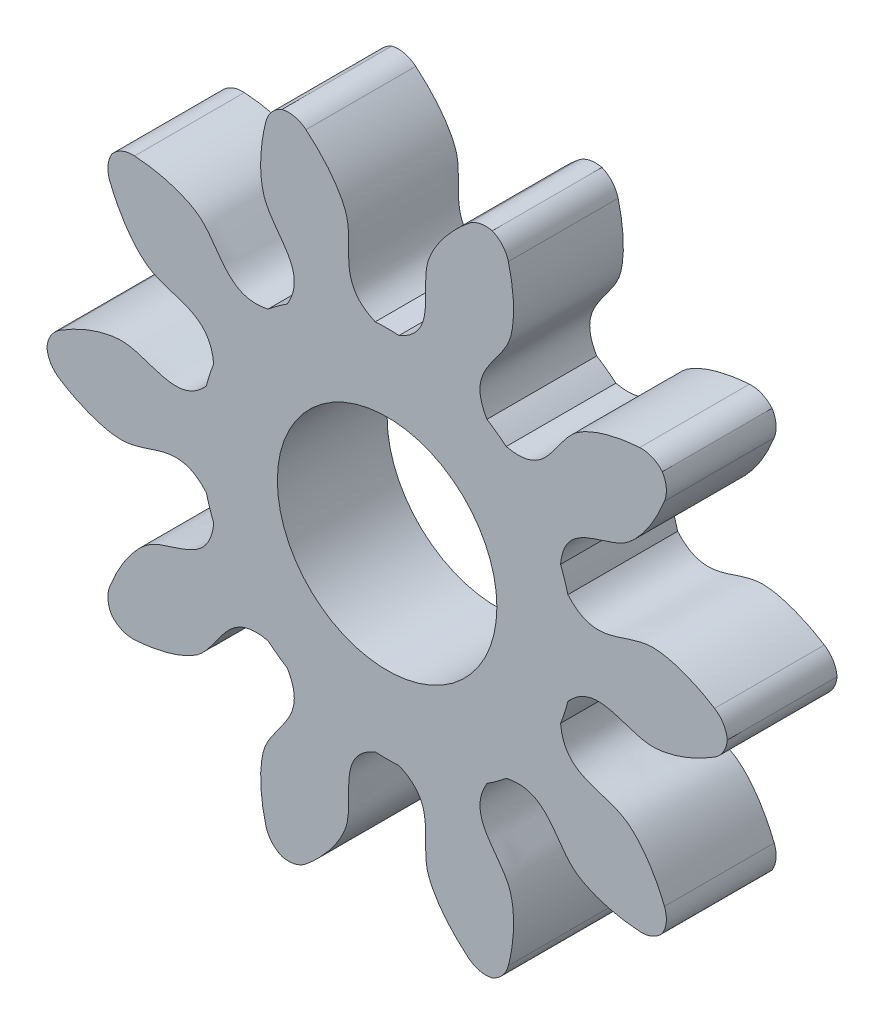
from build123d import *

# Parameters (mm, degrees)
SKETCH_1_R               = 6.2
EXTRUDE_1_DEPTH          = 2
CUT_EXTRUDE_1_DEPTH      = 9.993330862
PATTERN_CIRCULAR_1_COUNT = 10
FILLET_START             = -1
FILLET_1_DEPTH           = 4
PATTERN_CIRCULAR_2_COUNT = 10
SKETCH_4_R               = 2
CUT_EXTRUDE_2_DEPTH      = 9.794049568


with BuildPart() as part:
    # 草图1 → 凸台-拉伸1 (new body)
    with BuildSketch(Plane.XY):
        Circle(SKETCH_1_R)
    extrude(amount=EXTRUDE_1_DEPTH)

    # 草图2 → 切除-拉伸1 (cut, through all)
    with BuildSketch(Plane.XY):
        with BuildLine():
            ThreePointArc((0.216461071, 3.393102504), (0, 3.4), (-0.216461071, 3.393102504))
            add(Edge.make_bspline(
                [(-0.216461071, 3.393102504), (-0.938538331, 3.702538671), (-0.587766178, 4.361002055), (-0.755043124, 4.860887482), (-0.76122395, 4.878213624), (-0.768437165, 4.897223258), (-0.776750957, 4.917881586), (-0.786234278, 4.940151385), (-0.79695448, 4.963993454), (-0.808977961, 4.989366515), (-0.822369902, 5.016227278), (-0.837194274, 5.044530464), (-0.853513767, 5.074228838), (-0.87138974, 5.10527324), (-0.890882173, 5.137612624), (-0.912049612, 5.171194089), (-0.934949121, 5.20596292), (-0.95963623, 5.241862624), (-0.986164895, 5.278834969), (-1.014587439, 5.31682003), (-1.044954517, 5.355756224), (-1.077315063, 5.395580357), (-1.11171625, 5.436227669), (-1.148203448, 5.477631878), (-1.186820177, 5.519725226), (-1.227608074, 5.562438528), (-1.270606844, 5.605701218), (-1.315854232, 5.649441405), (-1.363385978, 5.693585914), (-1.413235784, 5.738060347), (-1.465435281, 5.782789128), (-1.520013993, 5.827695561), (-1.576999308, 5.872701882), (-1.636416442, 5.917729317), (-1.698288417, 5.962698132), (-1.762636028, 6.007527695), (-1.829477818, 6.052136532), (-1.898830051, 6.096442384), (-1.970706693, 6.140362265), (-2.045119386, 6.183812523), (-2.122077425, 6.2267089), (-2.201587745, 6.268966591), (-2.283654899, 6.310500306), (-2.368281041, 6.351224332), (-2.455465914, 6.391052592), (-2.545206835, 6.429898712), (-2.637498682, 6.467676079), (-2.732333887, 6.504297907), (-2.829702424, 6.539677301), (-2.929591804, 6.573727317), (-3.031987069, 6.60636103), (-3.136870786, 6.637491596), (-3.244223049, 6.667032315), (-3.354021472, 6.694896698), (-3.466241195, 6.720998532), (-3.580854886, 6.74525194), (-3.697832739, 6.76757145), (-3.817142488, 6.787872057), (-3.938749409, 6.80606929), (-4.062616327, 6.822079272), (-4.188703632, 6.835818791), (-4.316969286, 6.847205355), (-4.44736884, 6.856157263), (-4.579855445, 6.862593668), (-4.714379872, 6.866434634), (-4.85089053, 6.867601208), (-4.989333483, 6.866015474), (-5.129652475, 6.861600622), (-5.271788949, 6.854281006), (-5.415682074, 6.843982203), (-5.561268772, 6.830631082), (-5.708483742, 6.814155854), (-5.857259491, 6.794486139), (-6.007526363, 6.771553021), (-6.159212575, 6.745289109), (-6.312244245, 6.715628592), (-6.46654543, 6.682507298), (-6.622038162, 6.645862747), (-6.778642483, 6.605634211), (-6.936276489, 6.561762765), (-7.094856367, 6.51419134), (-7.254296437, 6.462864779), (-7.414509197, 6.407729886), (-7.575405364, 6.348735476), (-7.736893924, 6.28583243), (-7.898882176, 6.218973738), (-8.061275785, 6.148114546), (-8.223978816, 6.073212213), (-8.442360448, 5.967334523), (-8.604560645, 5.882562478), (-8.712098668, 5.823620802)],
                knots=[0, 0, 0, 0, 0.148596065, 0.150177563, 0.151945119, 0.153898734, 0.156038407, 0.158364139, 0.160875929, 0.163573778, 0.166457686, 0.169527652, 0.172783677, 0.17622576, 0.179853902, 0.183668102, 0.187668361, 0.191854678, 0.196227054, 0.200785489, 0.205529982, 0.210460534, 0.215577144, 0.220879813, 0.22636854, 0.232043326, 0.23790417, 0.243951073, 0.250184035, 0.256603055, 0.263208133, 0.26999927, 0.276976466, 0.28413972, 0.291489033, 0.299024405, 0.306745835, 0.314653323, 0.32274687, 0.331026476, 0.33949214, 0.348143862, 0.356981644, 0.366005483, 0.375215382, 0.384611339, 0.394193354, 0.403961428, 0.413915561, 0.424055752, 0.434382001, 0.44489431, 0.455592676, 0.466477102, 0.477547586, 0.488804128, 0.500246729, 0.511875388, 0.523690106, 0.535690883, 0.547877718, 0.560250612, 0.572809564, 0.585554575, 0.598485644, 0.611602772, 0.624905959, 0.638395204, 0.652070507, 0.66593187, 0.67997929, 0.69421277, 0.708632307, 0.723237904, 0.738029559, 0.753007272, 0.768171044, 0.783520875, 0.799056764, 0.814778711, 0.830686718, 0.846780782, 0.863060906, 0.879527087, 0.896179328, 0.913017627, 0.930041984, 0.9472524, 0.964648875, 1, 1, 1, 1], degree=3))
            ThreePointArc((-8.712098668, 5.823620802), (0, 10.479275855), (8.712098668, 5.823620802))
            add(Edge.make_bspline(
                [(0.216461071, 3.393102504), (0.938538331, 3.702538671), (0.587766178, 4.361002055), (0.755043124, 4.860887482), (0.76122395, 4.878213624), (0.768437165, 4.897223258), (0.776750957, 4.917881586), (0.786234278, 4.940151385), (0.79695448, 4.963993454), (0.808977961, 4.989366515), (0.822369902, 5.016227278), (0.837194274, 5.044530464), (0.853513767, 5.074228838), (0.87138974, 5.10527324), (0.890882173, 5.137612624), (0.912049612, 5.171194089), (0.934949121, 5.20596292), (0.95963623, 5.241862624), (0.986164895, 5.278834969), (1.014587439, 5.31682003), (1.044954517, 5.355756224), (1.077315063, 5.395580357), (1.11171625, 5.436227669), (1.148203448, 5.477631878), (1.186820177, 5.519725226), (1.227608074, 5.562438528), (1.270606844, 5.605701218), (1.315854232, 5.649441405), (1.363385978, 5.693585914), (1.413235784, 5.738060347), (1.465435281, 5.782789128), (1.520013993, 5.827695561), (1.576999308, 5.872701882), (1.636416442, 5.917729317), (1.698288417, 5.962698132), (1.762636028, 6.007527695), (1.829477818, 6.052136532), (1.898830051, 6.096442384), (1.970706693, 6.140362265), (2.045119386, 6.183812523), (2.122077425, 6.2267089), (2.201587745, 6.268966591), (2.283654899, 6.310500306), (2.368281041, 6.351224332), (2.455465914, 6.391052592), (2.545206835, 6.429898712), (2.637498682, 6.467676079), (2.732333887, 6.504297907), (2.829702424, 6.539677301), (2.929591804, 6.573727317), (3.031987069, 6.60636103), (3.136870786, 6.637491596), (3.244223049, 6.667032315), (3.354021472, 6.694896698), (3.466241195, 6.720998532), (3.580854886, 6.74525194), (3.697832739, 6.76757145), (3.817142488, 6.787872057), (3.938749409, 6.80606929), (4.062616327, 6.822079272), (4.188703632, 6.835818791), (4.316969286, 6.847205355), (4.44736884, 6.856157263), (4.579855445, 6.862593668), (4.714379872, 6.866434634), (4.85089053, 6.867601208), (4.989333483, 6.866015474), (5.129652475, 6.861600622), (5.271788949, 6.854281006), (5.415682074, 6.843982203), (5.561268772, 6.830631082), (5.708483742, 6.814155854), (5.857259491, 6.794486139), (6.007526363, 6.771553021), (6.159212575, 6.745289109), (6.312244245, 6.715628592), (6.46654543, 6.682507298), (6.622038162, 6.645862747), (6.778642483, 6.605634211), (6.936276489, 6.561762765), (7.094856367, 6.51419134), (7.254296437, 6.462864779), (7.414509197, 6.407729886), (7.575405364, 6.348735476), (7.736893924, 6.28583243), (7.898882176, 6.218973738), (8.061275785, 6.148114546), (8.223978816, 6.073212213), (8.442360448, 5.967334523), (8.604560645, 5.882562478), (8.712098668, 5.823620802)],
                knots=[0, 0, 0, 0, 0.148596065, 0.150177563, 0.151945119, 0.153898734, 0.156038407, 0.158364139, 0.160875929, 0.163573778, 0.166457686, 0.169527652, 0.172783677, 0.17622576, 0.179853902, 0.183668102, 0.187668361, 0.191854678, 0.196227054, 0.200785489, 0.205529982, 0.210460534, 0.215577144, 0.220879813, 0.22636854, 0.232043326, 0.23790417, 0.243951073, 0.250184035, 0.256603055, 0.263208133, 0.26999927, 0.276976466, 0.28413972, 0.291489033, 0.299024405, 0.306745835, 0.314653323, 0.32274687, 0.331026476, 0.33949214, 0.348143862, 0.356981644, 0.366005483, 0.375215382, 0.384611339, 0.394193354, 0.403961428, 0.413915561, 0.424055752, 0.434382001, 0.44489431, 0.455592676, 0.466477102, 0.477547586, 0.488804128, 0.500246729, 0.511875388, 0.523690106, 0.535690883, 0.547877718, 0.560250612, 0.572809564, 0.585554575, 0.598485644, 0.611602772, 0.624905959, 0.638395204, 0.652070507, 0.66593187, 0.67997929, 0.69421277, 0.708632307, 0.723237904, 0.738029559, 0.753007272, 0.768171044, 0.783520875, 0.799056764, 0.814778711, 0.830686718, 0.846780782, 0.863060906, 0.879527087, 0.896179328, 0.913017627, 0.930041984, 0.9472524, 0.964648875, 1, 1, 1, 1], degree=3))
        make_face()
    cut_extrude_1 = extrude(amount=CUT_EXTRUDE_1_DEPTH, mode=Mode.SUBTRACT)

    # 阵列(圆周)1: 切除-拉伸1 ×10 about axis
    pattern_circular_1_axis = Axis((0, 0, 2), (0, 0, -1))
    for i in range(1, PATTERN_CIRCULAR_1_COUNT):
        add(cut_extrude_1.rotate(pattern_circular_1_axis, i * 360 / PATTERN_CIRCULAR_1_COUNT), mode=Mode.SUBTRACT)

    # 圆角1: read off the stored shape, not the designer's step
    # 圆角1 outline → 圆角1 (cut)
    with BuildSketch(Plane.XY.offset(FILLET_START)):
        with BuildLine():
            ThreePointArc((1.478504386, 5.793405758), (1.684921183, 5.895943624), (1.915401149, 5.894998582))
            ThreePointArc((1.915401149, 5.894998582), (2.102418839, 5.760290412), (2.20914329, 5.556006787))
            add(Edge.make_bspline(
                [(2.13046399, 5.822467105), (2.130576892, 5.822131073), (2.138806189, 5.797626954), (2.154465308, 5.749405037), (2.176068318, 5.678052562), (2.194139594, 5.613756527), (2.204776119, 5.57319176), (2.20914329, 5.556006787)],
                knots=[0.708408777, 0.708408777, 0.708408777, 0.708408777, 0.708510967, 0.71586028, 0.723023534, 0.73000073, 0.735112102, 0.735112102, 0.735112102, 0.735112102], degree=3))
            ThreePointArc((2.13046399, 5.822467105), (1.915905365, 5.896550401), (1.698778722, 5.962730151))
            add(Edge.make_bspline(
                [(1.478504386, 5.793405758), (1.492138576, 5.804741734), (1.524587077, 5.831307328), (1.576999308, 5.872701882), (1.636416442, 5.917729317), (1.677429067, 5.947537468), (1.698489868, 5.962524658), (1.698778722, 5.962730151)],
                knots=[0.264887898, 0.264887898, 0.264887898, 0.264887898, 0.26999927, 0.276976466, 0.28413972, 0.291489033, 0.291591223, 0.291591223, 0.291591223, 0.291591223], degree=3))
        make_face()
    fillet_1 = extrude(amount=FILLET_1_DEPTH, mode=Mode.SUBTRACT)

    # 阵列(圆周)2: 圆角1 ×10 about axis
    pattern_circular_2_axis = Axis((0, 0, 0), (0, 0, 1))
    for i in range(1, PATTERN_CIRCULAR_2_COUNT):
        add(fillet_1.rotate(pattern_circular_2_axis, i * 360 / PATTERN_CIRCULAR_2_COUNT), mode=Mode.SUBTRACT)

    # 草图4 → 切除-拉伸2 (cut, through all)
    with BuildSketch(Plane.XY.offset(2)):
        Circle(SKETCH_4_R)
    extrude(amount=-CUT_EXTRUDE_2_DEPTH, mode=Mode.SUBTRACT)


solid = part.part
